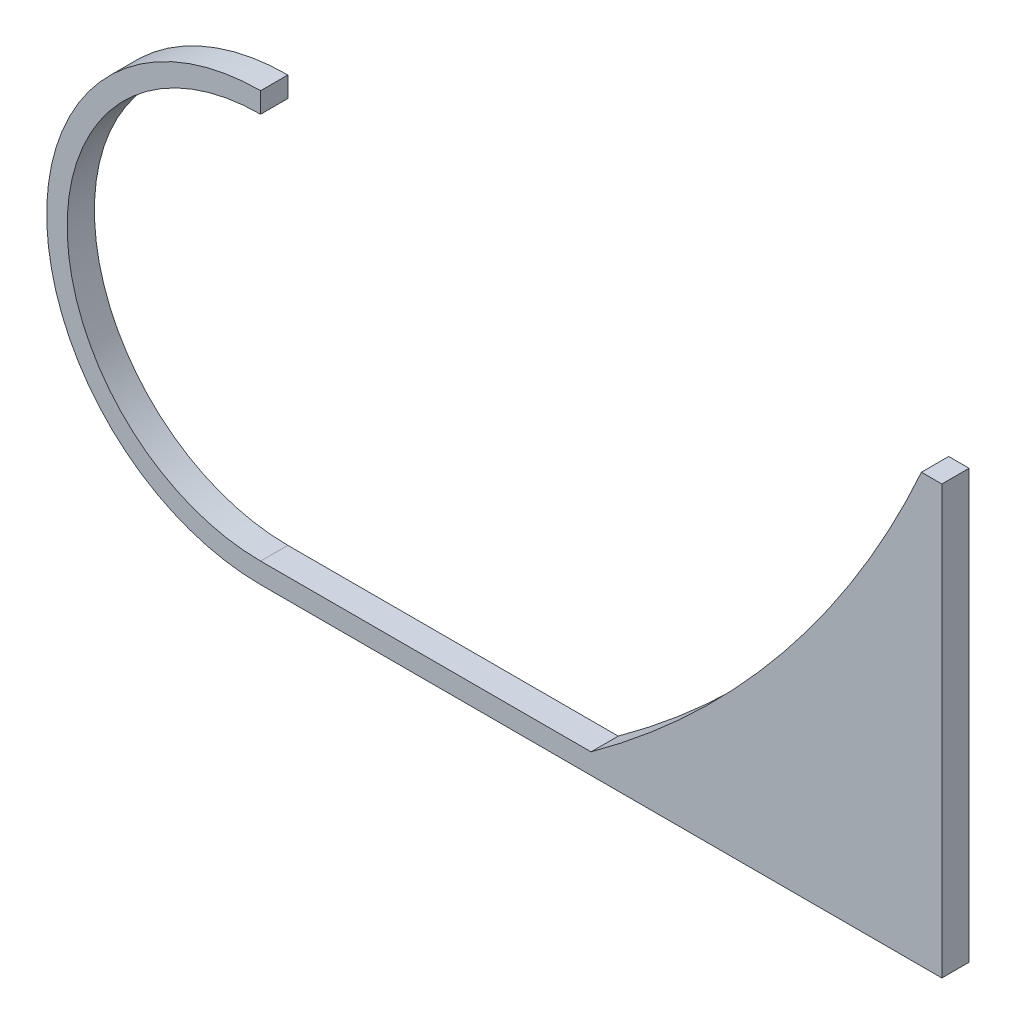
from build123d import *

# Parameters (mm, degrees)
SKETCH1_R               = 19.939
CIRCLE_EXTRUDE_DEPTH    = 2.54
SKETCH3_W               = 2.54
SKETCH3_H               = 39.878
RECTANGLE_EXTRUDE_DEPTH = 63.5
SKETCH2_R               = 18.034
CIRCLE_CUT_DEPTH        = 2.54
SKETCH6_W               = 61.595
SKETCH6_H               = 37.973
RECTANGLE_CUT_DEPTH     = 67.605294992
BOSS_EXTRUDE1_DEPTH     = 2.54


with BuildPart() as part:
    # Sketch1 → circle extrude (new body)
    with BuildSketch(Plane.XY):
        Circle(SKETCH1_R)
    extrude(amount=CIRCLE_EXTRUDE_DEPTH)

    # Sketch3 → rectangle extrude (add)
    with BuildSketch(Plane(origin=(0, 0, 0), x_dir=(0, 0, -1), z_dir=(1, 0, 0))):
        with Locations((-1.27, 0)):
            Rectangle(SKETCH3_W, SKETCH3_H)
    extrude(amount=RECTANGLE_EXTRUDE_DEPTH)

    # Sketch2 → circle cut (cut)
    with BuildSketch(Plane.XY.offset(2.54)):
        Circle(SKETCH2_R)
    extrude(amount=-CIRCLE_CUT_DEPTH, mode=Mode.SUBTRACT)

    # Sketch6 → rectangle cut (cut, through all)
    with BuildSketch(Plane.XY.offset(2.54)):
        with Locations((30.7975, 0.9525)):
            Rectangle(SKETCH6_W, SKETCH6_H)
    extrude(amount=-RECTANGLE_CUT_DEPTH, mode=Mode.SUBTRACT)


with BuildPart() as body_2:
    # Sketch9 → Boss-Extrude1 (new body)
    with BuildSketch(Plane.XY.offset(2.54)):
        with BuildLine():
            Line((61.595, 19.939), (61.595, -18.034))
            Line((61.595, -18.034), (30.7975, -18.034))
            ThreePointArc((30.7975, -18.034), (48.695870145, -1.074783897), (61.595, 19.939))
        make_face()
    extrude(amount=-BOSS_EXTRUDE1_DEPTH)


with BuildPart() as part_1:
    add(part.part)

    # Combine1: union body 2
    add(body_2.part)


solid = part_1.part
